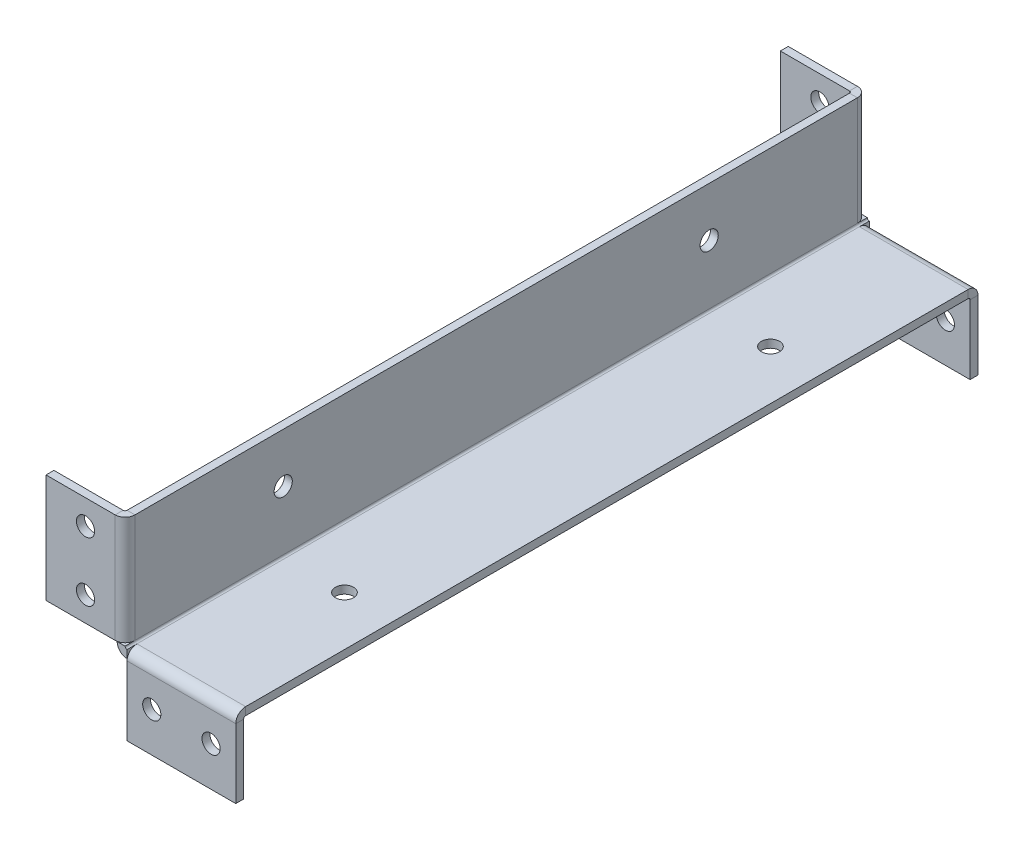
from build123d import *

# Parameters (mm, degrees)
SKETCH1_W                      = 60
SKETCH1_H                      = 375.5
BASE_FLANGE1_DEPTH             = 4
EDGE_FLANGE1_STRIP_W           = 18
EDGE_FLANGE1_STRIP_H           = 4
EDGE_FLANGE1_STRIP_CUT_DEPTH   = 375.5
EDGE_FLANGE1_DEPTH             = 375.5
EDGE_FLANGE2_STRIP_W           = 18
EDGE_FLANGE2_STRIP_H           = 4
EDGE_FLANGE2_STRIP_CUT_DEPTH   = 55
EDGE_FLANGE2_STRIP_2_W         = 18
EDGE_FLANGE2_STRIP_2_H         = 4
EDGE_FLANGE2_STRIP_CUT_2_DEPTH = 55
EDGE_FLANGE2_STRIP_3_W         = 18
EDGE_FLANGE2_STRIP_3_H         = 4
EDGE_FLANGE2_STRIP_CUT_3_DEPTH = 55
EDGE_FLANGE2_STRIP_4_W         = 18
EDGE_FLANGE2_STRIP_4_H         = 4
EDGE_FLANGE2_STRIP_CUT_4_DEPTH = 55
EDGE_FLANGE2_DEPTH             = 55
EDGE_FLANGE2_BEND_DEPTH        = 55
EDGE_FLANGE2_BEND_2_DEPTH      = 55
EDGE_FLANGE2_BEND_3_DEPTH      = 55
SKETCH18_R                     = 4.6
EXTRUDE1_DEPTH                 = 386.948506928
SKETCH19_R                     = 4.6
EXTRUDE2_DEPTH                 = 4
SKETCH20_R                     = 4.6
EXTRUDE3_DEPTH                 = 4


# Sheet-metal steps are written as plain solids
with BuildPart() as part:
    # Sketch1 → Base-Flange1 (new body)
    with BuildSketch(Plane(origin=(0, 0, 0), x_dir=(1, 0, 0), z_dir=(0, 1, 0))):
        Rectangle(SKETCH1_W, SKETCH1_H)
    extrude(amount=BASE_FLANGE1_DEPTH)

    # Edge-Flange1 strip (across the edge) → Edge-Flange1 strip cut (cut)
    with BuildSketch(Plane(origin=(-30, 4, -187.75), x_dir=(1, 0, 0), z_dir=(0, 0, 1))):
        with Locations((-4, -2)):
            Rectangle(EDGE_FLANGE1_STRIP_W, EDGE_FLANGE1_STRIP_H)
    extrude(amount=EDGE_FLANGE1_STRIP_CUT_DEPTH, mode=Mode.SUBTRACT)

    # Edge-Flange1 section (across the edge) → Edge-Flange1 (add)
    with BuildSketch(Plane(origin=(-30, 4, -187.75), x_dir=(1, 0, 0), z_dir=(0, 0, 1))):
        with BuildLine():
            Line((0, 1), (0, 56))
            Line((0, 56), (4, 56))
            Line((4, 56), (4, 1))
            ThreePointArc((4, 1), (4.292893219, 0.292893219), (5, 0))
            Line((5, 0), (5, -4))
            ThreePointArc((5, -4), (1.464466094, -2.535533906), (0, 1))
        make_face()
    extrude(amount=EDGE_FLANGE1_DEPTH)

    # Edge-Flange2 strip (across the edge) → Edge-Flange2 strip cut (cut)
    with BuildSketch(Plane(origin=(-30, 5, 187.75), x_dir=(0, 0, -1), z_dir=(0, 1, 0))):
        with Locations((-4, -2)):
            Rectangle(EDGE_FLANGE2_STRIP_W, EDGE_FLANGE2_STRIP_H)
    extrude(amount=EDGE_FLANGE2_STRIP_CUT_DEPTH, mode=Mode.SUBTRACT)

    # Edge-Flange2 strip 2 (across the edge) → Edge-Flange2 strip cut 2 (cut)
    with BuildSketch(Plane(origin=(30, 0, 187.75), x_dir=(0, 0, -1), z_dir=(-1, 0, 0))):
        with Locations((-4, -2)):
            Rectangle(EDGE_FLANGE2_STRIP_2_W, EDGE_FLANGE2_STRIP_2_H)
    extrude(amount=EDGE_FLANGE2_STRIP_CUT_2_DEPTH, mode=Mode.SUBTRACT)

    # Edge-Flange2 strip 3 (across the edge) → Edge-Flange2 strip cut 3 (cut)
    with BuildSketch(Plane(origin=(-30, 60, -187.75), x_dir=(0, 0, 1), z_dir=(0, -1, 0))):
        with Locations((-4, -2)):
            Rectangle(EDGE_FLANGE2_STRIP_3_W, EDGE_FLANGE2_STRIP_3_H)
    extrude(amount=EDGE_FLANGE2_STRIP_CUT_3_DEPTH, mode=Mode.SUBTRACT)

    # Edge-Flange2 strip 4 (across the edge) → Edge-Flange2 strip cut 4 (cut)
    with BuildSketch(Plane(origin=(-25, 0, -187.75), x_dir=(0, 0, 1), z_dir=(1, 0, 0))):
        with Locations((-4, -2)):
            Rectangle(EDGE_FLANGE2_STRIP_4_W, EDGE_FLANGE2_STRIP_4_H)
    extrude(amount=EDGE_FLANGE2_STRIP_CUT_4_DEPTH, mode=Mode.SUBTRACT)

    # Edge-Flange2 section (across the edge) → Edge-Flange2 (add)
    with BuildSketch(Plane(origin=(-30, 5, 187.75), x_dir=(0, 0, -1), z_dir=(0, 1, 0))):
        with BuildLine():
            Line((0, 1), (0, 36))
            Line((0, 36), (4, 36))
            Line((4, 36), (4, 1))
            ThreePointArc((4, 1), (4.292893219, 0.292893219), (5, 0))
            Line((5, 0), (5, -4))
            ThreePointArc((5, -4), (1.464466094, -2.535533906), (0, 1))
        make_face()
    extrude(amount=EDGE_FLANGE2_DEPTH)

    # Edge-Flange2 section 2 (across the edge) → Edge-Flange2 bend (add)
    with BuildSketch(Plane(origin=(30, 0, 187.75), x_dir=(0, 0, -1), z_dir=(-1, 0, 0))):
        with BuildLine():
            Line((0, 1), (0, 36))
            Line((0, 36), (4, 36))
            Line((4, 36), (4, 1))
            ThreePointArc((4, 1), (4.292893219, 0.292893219), (5, 0))
            Line((5, 0), (5, -4))
            ThreePointArc((5, -4), (1.464466094, -2.535533906), (0, 1))
        make_face()
    extrude(amount=EDGE_FLANGE2_BEND_DEPTH)

    # Edge-Flange2 section 3 (across the edge) → Edge-Flange2 bend 2 (add)
    with BuildSketch(Plane(origin=(-30, 60, -187.75), x_dir=(0, 0, 1), z_dir=(0, -1, 0))):
        with BuildLine():
            Line((0, 1), (0, 36))
            Line((0, 36), (4, 36))
            Line((4, 36), (4, 1))
            ThreePointArc((4, 1), (4.292893219, 0.292893219), (5, 0))
            Line((5, 0), (5, -4))
            ThreePointArc((5, -4), (1.464466094, -2.535533906), (0, 1))
        make_face()
    extrude(amount=EDGE_FLANGE2_BEND_2_DEPTH)

    # Edge-Flange2 section 4 (across the edge) → Edge-Flange2 bend 3 (add)
    with BuildSketch(Plane(origin=(-25, 0, -187.75), x_dir=(0, 0, 1), z_dir=(1, 0, 0))):
        with BuildLine():
            Line((0, 1), (0, 36))
            Line((0, 36), (4, 36))
            Line((4, 36), (4, 1))
            ThreePointArc((4, 1), (4.292893219, 0.292893219), (5, 0))
            Line((5, 0), (5, -4))
            ThreePointArc((5, -4), (1.464466094, -2.535533906), (0, 1))
        make_face()
    extrude(amount=EDGE_FLANGE2_BEND_3_DEPTH)

    # Sketch18 → Extrude1 (cut, through all)
    with BuildSketch(Plane.XY.offset(187.75)):
        with Locations((-46, 47.5)):
            Circle(SKETCH18_R)
        with Locations((-46, 17.5)):
            Circle(SKETCH18_R)
        with Locations((-12.5, -16)):
            Circle(SKETCH18_R)
        with Locations((17.5, -16)):
            Circle(SKETCH18_R)
    extrude(amount=-EXTRUDE1_DEPTH, mode=Mode.SUBTRACT)

    # Sketch19 → Extrude2 (cut)
    with BuildSketch(Plane(origin=(-26, 0, 0), x_dir=(0, 0, -1), z_dir=(1, 0, 0))):
        with Locations(Location((-107.75, 35, 0), (0, 0, 90))):
            Circle(SKETCH19_R)
        with Locations(Location((107.75, 35, 0), (0, 0, 90))):
            Circle(SKETCH19_R)
    extrude(amount=-EXTRUDE2_DEPTH, mode=Mode.SUBTRACT)

    # Sketch20 → Extrude3 (cut)
    with BuildSketch(Plane(origin=(0, 4, 0), x_dir=(1, 0, 0), z_dir=(0, 1, 0))):
        with Locations(Location((5, 107.75, 0), (0, 0, 270))):
            Circle(SKETCH20_R)
        with Locations(Location((5, -107.75, 0), (0, 0, 270))):
            Circle(SKETCH20_R)
    extrude(amount=-EXTRUDE3_DEPTH, mode=Mode.SUBTRACT)


solid = part.part
